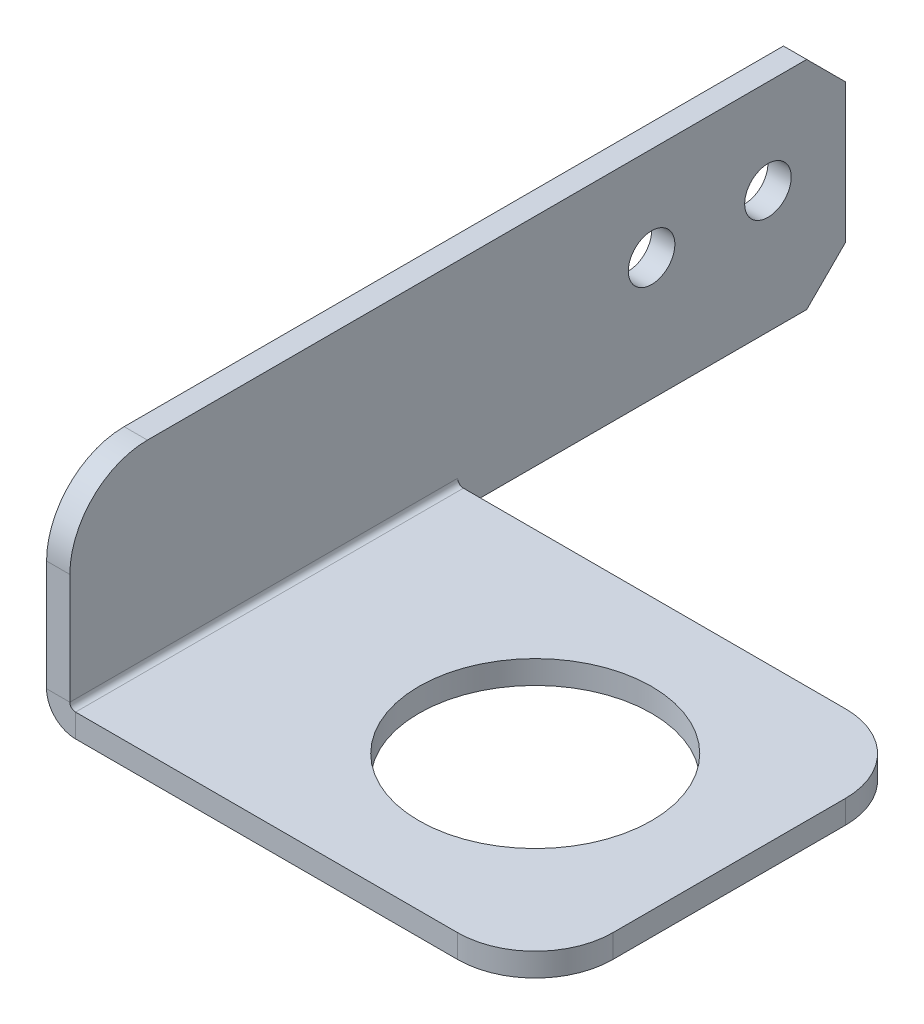
from build123d import *

# Parameters (mm, degrees)
SM_BASE_FLANGE_1_DEPTH = 100
SKETCH_3_W             = 60
SKETCH_3_H             = 50
CUT_EXTRUDE_1_DEPTH    = 120.933314805
SKETCH_4_R             = 15
CUT_EXTRUDE_2_DEPTH    = 120.268604419
SKETCH_5_R             = 3
CUT_EXTRUDE_3_DEPTH    = 120.268604419
FILLET_1_R             = 10
CUT_EXTRUDE_4_DEPTH    = 120.268604419


# Sheet-metal steps are written as plain solids
with BuildPart() as part:
    # Sketch 1 → 基体-法兰1 (new body)
    with BuildSketch(Plane.XY):
        with BuildLine():
            Line((0, 25), (0, 0.7366))
            ThreePointArc((0, 0.7366), (0.215745145, 0.215745145), (0.7366, 0))
            Line((0.7366, 0), (60, 0))
            Line((60, 0), (60, -3))
            Line((60, -3), (0.7366, -3))
            ThreePointArc((0.7366, -3), (-1.905575199, -1.905575199), (-3, 0.7366))
            Line((-3, 0.7366), (-3, 25))
            Line((-3, 25), (0, 25))
        make_face()
    extrude(amount=-SM_BASE_FLANGE_1_DEPTH)

    # 草图3 → 切除-拉伸1 (cut, through all)
    with BuildSketch(Plane(origin=(0, 25, 0), x_dir=(1, 0, 0), z_dir=(0, 1, 0))):
        with Locations((30, 75)):
            Rectangle(SKETCH_3_W, SKETCH_3_H)
    extrude(amount=-CUT_EXTRUDE_1_DEPTH, mode=Mode.SUBTRACT)

    # 草图4 → 切除-拉伸2 (cut, through all)
    with BuildSketch(Plane(origin=(0, 0, 0), x_dir=(1, 0, 0), z_dir=(0, 1, 0))):
        with Locations(Location((35, 25, 0), (0, 0, 270))):
            Circle(SKETCH_4_R)
    extrude(amount=-CUT_EXTRUDE_2_DEPTH, mode=Mode.SUBTRACT)

    # 草图5 → 切除-拉伸3 (cut, through all)
    with BuildSketch(Plane(origin=(0, 0, 0), x_dir=(0, 0, -1), z_dir=(1, 0, 0))):
        with Locations(Location((75, 12.8683, 0), (0, 0, 90))):
            Circle(SKETCH_5_R)
        with Locations(Location((90, 12.8683, 0), (0, 0, 90))):
            Circle(SKETCH_5_R)
    extrude(amount=-CUT_EXTRUDE_3_DEPTH, mode=Mode.SUBTRACT)

    # 圆角1
    fillet_1_edges = [part.edges().sort_by_distance(p)[0] for p in [
        (60, -1.5, -50),
        (-1.5, 25, 0),
        (60, -1.5, 0),
    ]]
    fillet(fillet_1_edges, radius=FILLET_1_R)

    # 草图6 → 切除-拉伸4 (cut, through all)
    with BuildSketch(Plane(origin=(0, 0, 0), x_dir=(0, 0, -1), z_dir=(1, 0, 0))):
        Polygon((100, 25), (95, 25), (100, 20), align=None)
        Polygon((100, 2.073322779), (100, -2.926677221), (95, -2.926677221), align=None)
    extrude(amount=-CUT_EXTRUDE_4_DEPTH, mode=Mode.SUBTRACT)


solid = part.part
